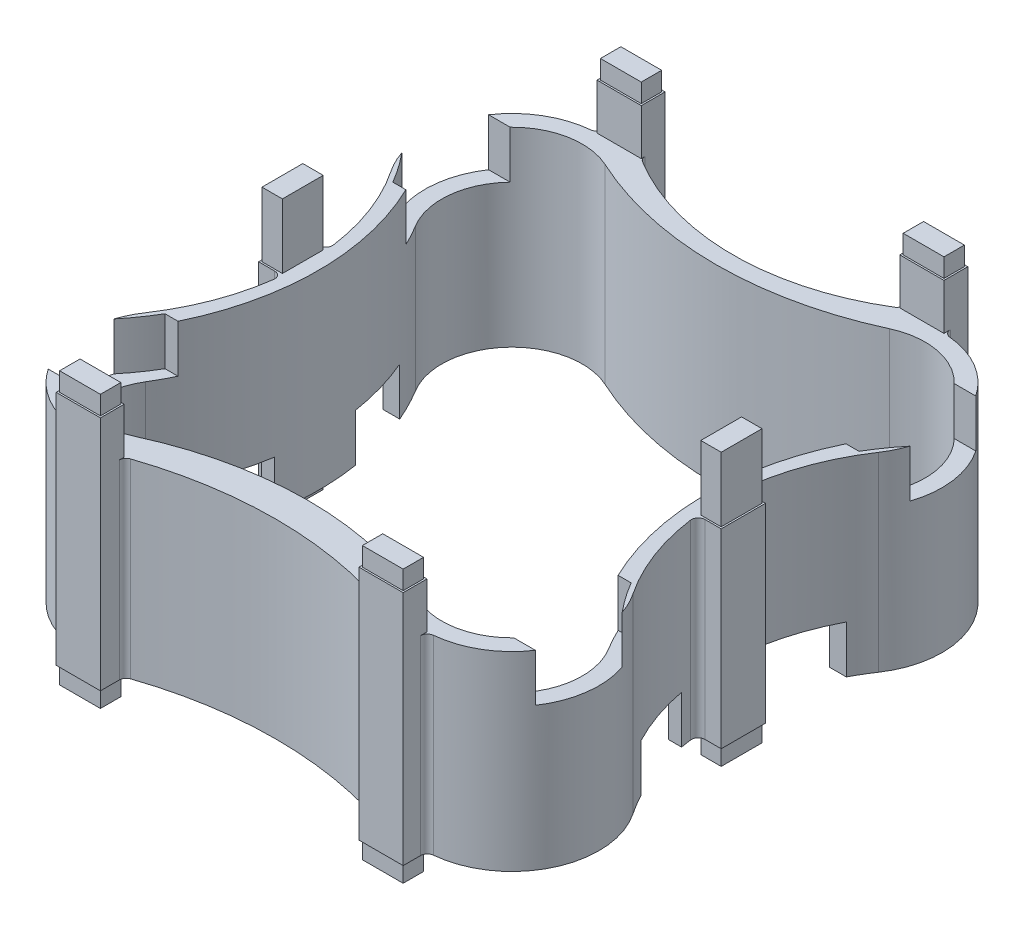
from build123d import *

# Parameters (mm, degrees)
F_28MM_7MM_DEPTH        = 28
SKETCH_9_W              = 6.5
SKETCH_9_H              = 3.5
EXTRUDE_7166_DEPTH      = 6.75
SKETCH_5_W              = 3
SKETCH_5_H              = 6
SKETCH_5_W_2            = 6
SKETCH_5_H_2            = 3
EXTRUDE_3_DEPTH         = 9.5
SKETCH_6_W              = 6
SKETCH_6_H              = 3
SKETCH_6_W_2            = 3
SKETCH_6_H_2            = 6
EXTRUDE_4_DEPTH         = 2.5
FILLET_1_R              = 1
CUT_EXTRUDE_11539_DEPTH = 7
CUT_EXTRUDE_START       = -7
CUT_EXTRUDE_11984_DEPTH = 7


with BuildPart() as part:
    # 草图2 → 主结构-28mm-铝柱补偿7mm (new body)
    with BuildSketch(Plane(origin=(0, 0, 0), x_dir=(1, 0, 0), z_dir=(0, 1, 0))):
        with BuildLine():
            Line((-30.5, 3.25), (-34, 3.25))
            Line((-34, 3.25), (-34, -3.25))
            Line((-34, -3.25), (-30.5, -3.25))
            ThreePointArc((-30.5, -3.25), (-32.254305361, -10.989802151), (-35.834688724, -18.072384985))
            ThreePointArc((-35.834688724, -18.072384985), (-36.566092953, -31.095350877), (-25.5, -38))
            Line((-25.5, -38), (-25.5, -41.5))
            Line((-25.5, -41.5), (-19, -41.5))
            Line((-19, -41.5), (-19, -38))
            ThreePointArc((-19, -38), (0, -34.737686486), (19, -38))
            Line((19, -38), (19, -41.5))
            Line((19, -41.5), (25.5, -41.5))
            Line((25.5, -41.5), (25.5, -38))
            ThreePointArc((25.5, -38), (36.566092953, -31.095350877), (35.834688724, -18.072384985))
            ThreePointArc((35.834688724, -18.072384985), (32.254305361, -10.989802151), (30.5, -3.25))
            Line((30.5, -3.25), (34, -3.25))
            Line((34, -3.25), (34, 3.25))
            Line((34, 3.25), (30.5, 3.25))
            ThreePointArc((30.5, 3.25), (32.254305361, 10.989802151), (35.834688724, 18.072384985))
            ThreePointArc((35.834688724, 18.072384985), (36.566092953, 31.095350877), (25.5, 38))
            Line((25.5, 38), (25.5, 41.5))
            Line((25.5, 41.5), (19, 41.5))
            Line((19, 41.5), (19, 38))
            ThreePointArc((19, 38), (0, 32.48661644), (-19, 38))
            Line((-19, 38), (-19, 41.5))
            Line((-19, 41.5), (-25.5, 41.5))
            Line((-25.5, 41.5), (-25.5, 38))
            ThreePointArc((-25.5, 38), (-36.566092953, 31.095350877), (-35.834688724, 18.072384985))
            ThreePointArc((-35.834688724, 18.072384985), (-32.254305361, 10.989802151), (-30.5, 3.25))
        make_face()
        with BuildLine():
            ThreePointArc((-20.875796354, 34.5817272), (-32.903231759, 32.085206292), (-34.039190328, 19.854040477))
            ThreePointArc((-34.039190328, 19.854040477), (-28.5, 0), (-34.039190328, -19.854040477))
            ThreePointArc((-34.039190328, -19.854040477), (-32.903231759, -32.085206292), (-20.875796354, -34.5817272))
            ThreePointArc((-20.875796354, -34.5817272), (0, -30), (20.875796354, -34.5817272))
            ThreePointArc((20.875796354, -34.5817272), (32.903231759, -32.085206292), (34.039190328, -19.854040477))
            ThreePointArc((34.039190328, -19.854040477), (28.5, 0), (34.039190328, 19.854040477))
            ThreePointArc((34.039190328, 19.854040477), (32.903231759, 32.085206292), (20.875796354, 34.5817272))
            ThreePointArc((20.875796354, 34.5817272), (0, 30), (-20.875796354, 34.5817272))
        make_face(mode=Mode.SUBTRACT)
    extrude(amount=-F_28MM_7MM_DEPTH)

    # 草图9 → Extrude 7166 (add)
    with BuildSketch(Plane(origin=(0, 0, 0), x_dir=(1, 0, 0), z_dir=(0, 1, 0))):
        with Locations((-22.25, 39.75)):
            Rectangle(SKETCH_9_W, SKETCH_9_H)
        with Locations((-22.25, -39.75)):
            Rectangle(SKETCH_9_W, SKETCH_9_H)
        with Locations((22.25, -39.75)):
            Rectangle(SKETCH_9_W, SKETCH_9_H)
        with Locations((22.25, 39.75)):
            Rectangle(SKETCH_9_W, SKETCH_9_H)
    extrude(amount=EXTRUDE_7166_DEPTH)

    # 草图5 → 凸台-拉伸3 (add)
    with BuildSketch(Plane(origin=(0, 0, 0), x_dir=(1, 0, 0), z_dir=(0, 1, 0))):
        with Locations((-32.25, 0)):
            Rectangle(SKETCH_5_W, SKETCH_5_H)
        with Locations((-22.25, -39.75)):
            Rectangle(SKETCH_5_W_2, SKETCH_5_H_2)
        with Locations((-22.25, 39.75)):
            Rectangle(SKETCH_5_W_2, SKETCH_5_H_2)
        with Locations((22.25, 39.75)):
            Rectangle(SKETCH_5_W_2, SKETCH_5_H_2)
        with Locations((22.25, -39.75)):
            Rectangle(SKETCH_5_W_2, SKETCH_5_H_2)
        with Locations((32.25, 0)):
            Rectangle(SKETCH_5_W, SKETCH_5_H)
    extrude(amount=EXTRUDE_3_DEPTH)

    # 草图6 → 凸台-拉伸4 (add)
    with BuildSketch(Plane.XZ.offset(28)):
        with Locations((-22.25, 39.75)):
            Rectangle(SKETCH_6_W, SKETCH_6_H)
        with Locations((-32.25, 0)):
            Rectangle(SKETCH_6_W_2, SKETCH_6_H_2)
        with Locations((-22.25, -39.75)):
            Rectangle(SKETCH_6_W, SKETCH_6_H)
        with Locations((22.25, 39.75)):
            Rectangle(SKETCH_6_W, SKETCH_6_H)
        with Locations((22.25, -39.75)):
            Rectangle(SKETCH_6_W, SKETCH_6_H)
        with Locations((32.25, 0)):
            Rectangle(SKETCH_6_W_2, SKETCH_6_H_2)
    extrude(amount=EXTRUDE_4_DEPTH)

    # 圆角1
    fillet_1_edges = [part.edges().sort_by_distance(p)[0] for p in [
        (30.5, -14, -3.25),
        (25.5, -14, -38),
        (-19, -14, -38),
        (19, -14, -38),
        (-25.5, -14, -38),
        (-30.5, -14, -3.25),
        (19, -14, 38),
        (30.5, -14, 3.25),
        (25.5, -14, 38),
        (-19, -14, 38),
        (-25.5, -14, 38),
        (-30.5, -14, 3.25),
    ]]
    fillet(fillet_1_edges, radius=FILLET_1_R)

    # 草图7 → Cut-Extrude 11539 (cut)
    with BuildSketch(Plane(origin=(0, 0, 0), x_dir=(1, 0, 0), z_dir=(0, 1, 0))):
        with BuildLine():
            Line((-34.258614228, -16.745907972), (-32.349220658, -16.745907972))
            ThreePointArc((-32.349220658, -16.745907972), (-33.158345791, -18.319472044), (-34.039190328, -19.854040477))
            ThreePointArc((-34.039190328, -19.854040477), (-35.467246173, -26.348657652), (-32.640912222, -32.367896154))
            Line((-32.640912222, -32.367896154), (-35.809718979, -32.367896154))
            ThreePointArc((-35.809718979, -32.367896154), (-37.885986771, -26.932030648), (-37.341643605, -21.138654061))
            ThreePointArc((-37.341643605, -21.138654061), (-35.710906447, -19.004901411), (-34.258614228, -16.745907972))
        make_face()
        with BuildLine():
            Line((34.258614228, -16.745907972), (32.349220658, -16.745907972))
            ThreePointArc((32.349220658, -16.745907972), (33.158345791, -18.319472044), (34.039190328, -19.854040477))
            ThreePointArc((34.039190328, -19.854040477), (35.467246173, -26.348657652), (32.640912222, -32.367896154))
            Line((32.640912222, -32.367896154), (35.809718979, -32.367896154))
            ThreePointArc((35.809718979, -32.367896154), (37.885986771, -26.932030648), (37.341643605, -21.138654061))
            ThreePointArc((37.341643605, -21.138654061), (35.710906447, -19.004901411), (34.258614228, -16.745907972))
        make_face()
        with BuildLine():
            Line((-34.258614228, 16.745907972), (-32.349220658, 16.745907972))
            ThreePointArc((-32.349220658, 16.745907972), (-33.158345791, 18.319472044), (-34.039190328, 19.854040477))
            ThreePointArc((-34.039190328, 19.854040477), (-35.467246173, 26.348657652), (-32.640912222, 32.367896154))
            Line((-32.640912222, 32.367896154), (-35.809718979, 32.367896154))
            ThreePointArc((-35.809718979, 32.367896154), (-37.885986771, 26.932030648), (-37.341643605, 21.138654061))
            ThreePointArc((-37.341643605, 21.138654061), (-35.710906447, 19.004901411), (-34.258614228, 16.745907972))
        make_face()
        with BuildLine():
            Line((35.809718979, 32.367896154), (32.640912222, 32.367896154))
            ThreePointArc((32.640912222, 32.367896154), (35.467246173, 26.348657652), (34.039190328, 19.854040477))
            ThreePointArc((34.039190328, 19.854040477), (33.158345791, 18.319472044), (32.349220658, 16.745907972))
            Line((32.349220658, 16.745907972), (34.258614228, 16.745907972))
            ThreePointArc((34.258614228, 16.745907972), (35.710906447, 19.004901411), (37.341643605, 21.138654061))
            ThreePointArc((37.341643605, 21.138654061), (37.885986771, 26.932030648), (35.809718979, 32.367896154))
        make_face()
    extrude(amount=-CUT_EXTRUDE_11539_DEPTH, mode=Mode.SUBTRACT)

    # 草图8 → Cut-Extrude 11984 (cut)
    with BuildSketch(Plane.XZ.offset(28).offset(CUT_EXTRUDE_START)):
        with BuildLine():
            Line((-30.887268933, -5.951627043), (-28.964627554, -5.951627043))
            ThreePointArc((-28.964627554, -5.951627043), (-29.99449743, -10.601746796), (-31.592809719, -15.088353923))
            Line((-31.592809719, -15.088353923), (-34.057723533, -15.088353923))
            ThreePointArc((-34.057723533, -15.088353923), (-32.130231431, -10.638756758), (-30.887268933, -5.951627043))
        make_face()
        with BuildLine():
            Line((-34.057723533, 15.088353923), (-31.592809719, 15.088353923))
            ThreePointArc((-31.592809719, 15.088353923), (-29.99449743, 10.601746796), (-28.964627554, 5.951627043))
            Line((-28.964627554, 5.951627043), (-30.887268933, 5.951627043))
            ThreePointArc((-30.887268933, 5.951627043), (-32.130231431, 10.638756758), (-34.057723533, 15.088353923))
        make_face()
        with BuildLine():
            Line((30.887268933, -5.951627043), (28.964627554, -5.951627043))
            ThreePointArc((28.964627554, -5.951627043), (29.99449743, -10.601746796), (31.592809719, -15.088353923))
            Line((31.592809719, -15.088353923), (34.057723533, -15.088353923))
            ThreePointArc((34.057723533, -15.088353923), (32.130231431, -10.638756758), (30.887268933, -5.951627043))
        make_face()
        with BuildLine():
            Line((30.887268933, 5.951627043), (28.964627554, 5.951627043))
            ThreePointArc((28.964627554, 5.951627043), (29.99449743, 10.601746796), (31.592809719, 15.088353923))
            Line((31.592809719, 15.088353923), (34.057723533, 15.088353923))
            ThreePointArc((34.057723533, 15.088353923), (32.130231431, 10.638756758), (30.887268933, 5.951627043))
        make_face()
    extrude(amount=CUT_EXTRUDE_11984_DEPTH, mode=Mode.SUBTRACT)


solid = part.part
